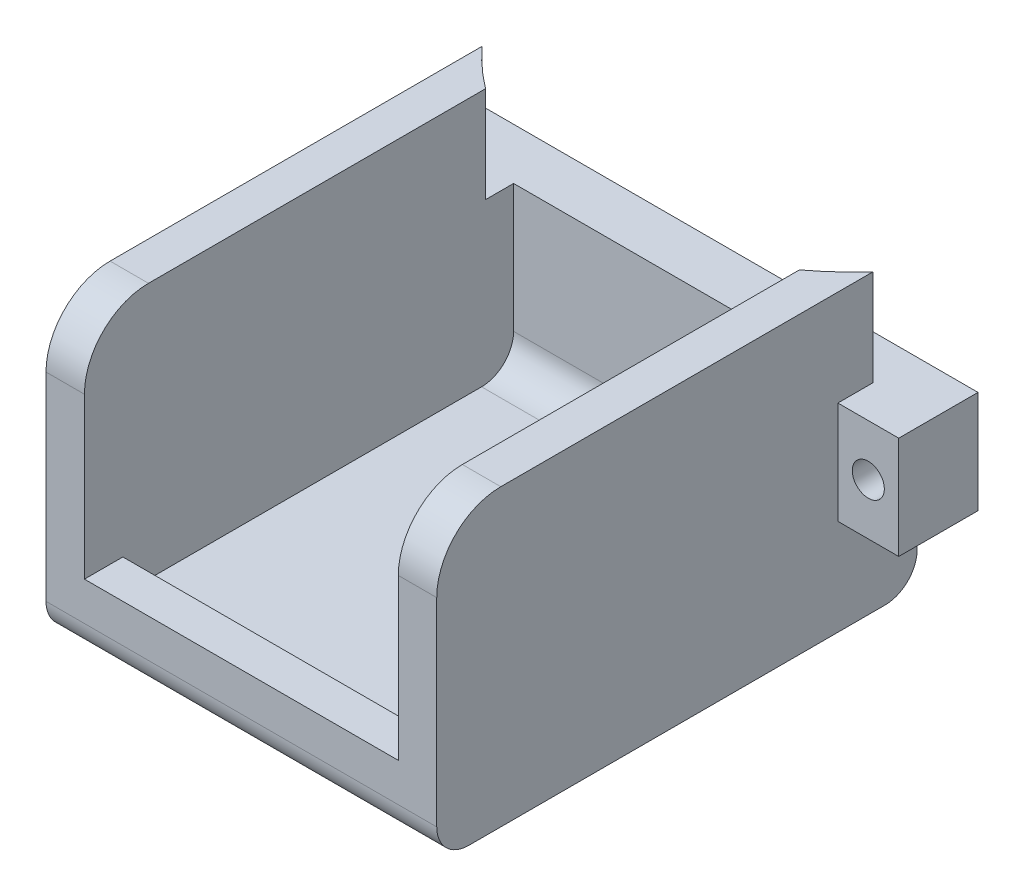
from build123d import *

# Parameters (mm, degrees)
SKETCH1_R                 = 40
BOSS_EXTRUDE1_DEPTH       = 16
SKETCH2_W                 = 41
SKETCH2_H                 = 41
CUT_EXTRUDE1_DEPTH        = 59.787753827
SKETCH13_W                = 61
SKETCH13_H                = 46
BOSS_EXTRUDE4_DEPTH       = 75
SKETCH14_W                = 49
SKETCH14_H                = 67
CUT_EXTRUDE2_DEPTH        = 35
SKETCH15_W                = 49
SKETCH15_H                = 61
CUT_EXTRUDE3_DEPTH        = 5
FILLET1_R                 = 10
FILLET2_R                 = 5
CUT_EXTRUDE5_REACH        = 110.08
SKETCH17_R                = 41
BOSS_EXTRUDE5_DEPTH       = 16
CUT_EXTRUDE4_DEPTH        = 118.224144271
CUT_EXTRUDE4_DEPTH_BACK   = 118.224144271
SKETCH16_R                = 3
F_5_0MM_DOWEL_HOLE1_D     = 5
F_5_0MM_DOWEL_HOLE1_DEPTH = 25
F_5_0MM_DOWEL_HOLE1_TIP   = 1.502151548
CUT_EXTRUDE7_DEPTH        = 123.446927311
CUT_EXTRUDE7_DEPTH_BACK   = 123.446927311
SKETCH22_W                = 41
SKETCH22_H                = 41


with BuildPart() as part:
    # Sketch1 → Boss-Extrude1 (new body)
    with BuildSketch(Plane(origin=(0, 0, 0), x_dir=(1, 0, 0), z_dir=(0, 1, 0))):
        with Locations(Location((0, 0, 0), (0, 0, 270))):
            Circle(SKETCH1_R)
    extrude(amount=BOSS_EXTRUDE1_DEPTH)

    # Sketch2 → Cut-Extrude1 (cut, through all)
    with BuildSketch(Plane(origin=(0, 16, 0), x_dir=(1, 0, 0), z_dir=(0, 1, 0))):
        Rectangle(SKETCH2_W, SKETCH2_H)
    extrude(amount=-CUT_EXTRUDE1_DEPTH, mode=Mode.SUBTRACT)

    # Sketch13 → Boss-Extrude4 (add)
    with BuildSketch(Plane(origin=(0, 0, 20.5), x_dir=(-1, 0, 0), z_dir=(0, 0, -1))):
        with Locations((0, 8)):
            Rectangle(SKETCH13_W, SKETCH13_H)
    extrude(amount=-BOSS_EXTRUDE4_DEPTH)

    # Sketch14 → Cut-Extrude2 (cut)
    with BuildSketch(Plane(origin=(0, 31, 0), x_dir=(1, 0, 0), z_dir=(0, 1, 0))):
        with Locations((0, -62)):
            Rectangle(SKETCH14_W, SKETCH14_H)
    extrude(amount=-CUT_EXTRUDE2_DEPTH, mode=Mode.SUBTRACT)

    # Sketch15 → Cut-Extrude3 (cut)
    with BuildSketch(Plane(origin=(0, -4, 0), x_dir=(1, 0, 0), z_dir=(0, 1, 0))):
        with Locations((0, -59)):
            Rectangle(SKETCH15_W, SKETCH15_H)
    extrude(amount=-CUT_EXTRUDE3_DEPTH, mode=Mode.SUBTRACT)

    # Fillet1
    fillet1_edges = [part.edges().sort_by_distance(p)[0] for p in [
        (-27.5, 31, 95.5),
        (27.5, 31, 95.5),
    ]]
    fillet(fillet1_edges, radius=FILLET1_R)

    # Fillet2
    fillet2_edges = [part.edges().sort_by_distance(p)[0] for p in [
        (0, -9, 89.5),
        (0, -15, 95.5),
        (0, -15, 20.5),
        (0, -9, 28.5),
    ]]
    fillet(fillet2_edges, radius=FILLET2_R - 0.0001)  # a hair under: the kernel refuses the full size

    # Sketch17 → Cut-Extrude5 (cut, up to next)
    with BuildSketch(Plane(origin=(0, 16, 0), x_dir=(1, 0, 0), z_dir=(0, 1, 0)), mode=Mode.PRIVATE) as cut_extrude5_sk1:
        Circle(SKETCH17_R)
    cut_extrude5_tool1 = extrude(cut_extrude5_sk1.sketch, amount=CUT_EXTRUDE5_REACH, mode=Mode.PRIVATE) & part.part
    add(cut_extrude5_tool1.solids().sort_by_distance((0, 16, 0))[0], mode=Mode.SUBTRACT)

    # Sketch18 → Boss-Extrude5 (add)
    with BuildSketch(Plane(origin=(0, 16, 0), x_dir=(1, 0, 0), z_dir=(0, 1, 0))):
        Polygon((20.5, 0), (20.5, -20.5), (-20.5, -20.5), (-20.5, 0), (-40, 0), (-40, -32.874762357), (-24.5, -32.874762357), (-24.5, -28.5), (24.5, -28.5), (24.5, -32.874762357), (40, -32.874762357), (40, 0), align=None)
    extrude(amount=-BOSS_EXTRUDE5_DEPTH)

    # Sketch16 → Cut-Extrude4 (cut, two sides: drawn at the far end of the back side and taken through both)
    with BuildSketch(Plane.ZY.offset(-20.5).offset(-CUT_EXTRUDE4_DEPTH_BACK)):
        with Locations(Location((0, 8, 0), (0, 0, 270))):
            Circle(SKETCH16_R)
    extrude(amount=CUT_EXTRUDE4_DEPTH + CUT_EXTRUDE4_DEPTH_BACK, mode=Mode.SUBTRACT)

    # Ø5.0mm Dowel Hole1
    with Locations(Plane(origin=(-35.25, 8, 32.874762357), x_dir=(1, 0, 0), z_dir=(0, 0, 1))):
        with Locations((0, 0), (70.5, 0)):
            Hole(F_5_0MM_DOWEL_HOLE1_D / 2, depth=F_5_0MM_DOWEL_HOLE1_DEPTH)
            with Locations((0, 0, -(F_5_0MM_DOWEL_HOLE1_DEPTH + F_5_0MM_DOWEL_HOLE1_TIP / 2))):  # 118° drill point
                Cone(0, F_5_0MM_DOWEL_HOLE1_D / 2, F_5_0MM_DOWEL_HOLE1_TIP, mode=Mode.SUBTRACT)

    # Sketch22 → Cut-Extrude7 (cut, two sides: drawn at the far end of the back side and taken through both)
    with BuildSketch(Plane(origin=(0, 16, -16), x_dir=(1, 0, 0), z_dir=(0, -1, 0)).offset(-CUT_EXTRUDE7_DEPTH_BACK)):
        with Locations((0, 16)):
            Rectangle(SKETCH22_W, SKETCH22_H)
        with BuildLine():
            Line((40, 16), (40, 36.5))
            Line((40, 36.5), (20.5, 36.5))
            Line((20.5, 36.5), (20.5, -4.5))
            Line((20.5, -4.5), (-20.5, -4.5))
            Line((-20.5, -4.5), (-20.5, 36.5))
            Line((-20.5, 36.5), (-40, 36.5))
            Line((-40, 36.5), (-40, 16))
            ThreePointArc((-40, 16), (-28.284271226, -12.284271269), (6.1e-08, -24))
            ThreePointArc((6.1e-08, -24), (28.284271269, -12.284271226), (40, 16))
        make_face()
        with BuildLine():
            Line((40, -24), (40, 16))
            ThreePointArc((40, 16), (28.284271269, -12.284271226), (6.1e-08, -24))
            Line((6.1e-08, -24), (40, -24))
        make_face()
        with BuildLine():
            Line((-40, -24), (6.1e-08, -24))
            ThreePointArc((6.1e-08, -24), (-28.284271226, -12.284271269), (-40, 16))
            Line((-40, 16), (-40, -24))
        make_face()
    extrude(amount=CUT_EXTRUDE7_DEPTH + CUT_EXTRUDE7_DEPTH_BACK, mode=Mode.SUBTRACT)


solid = part.part
